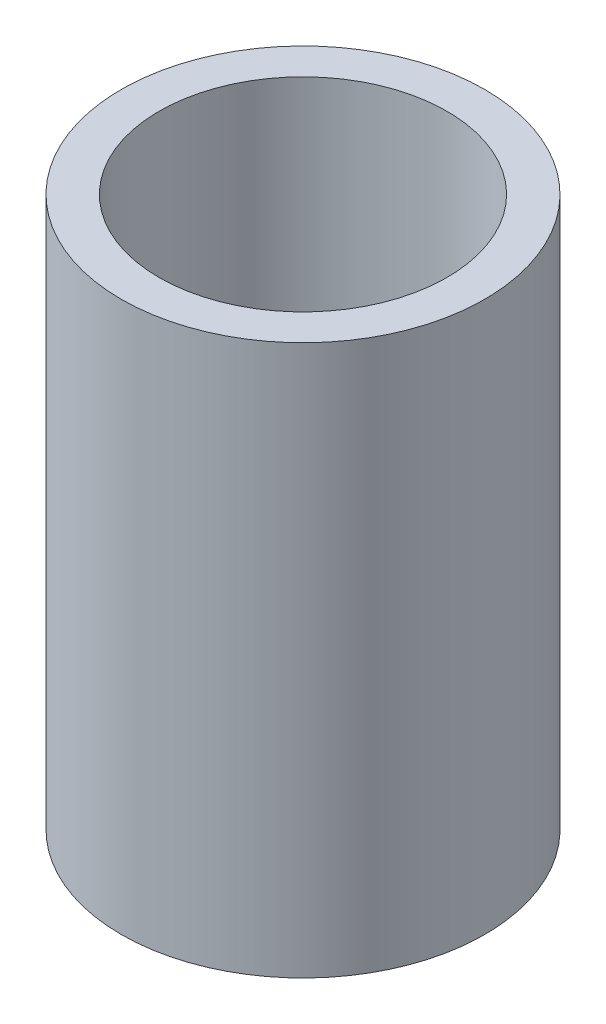
from build123d import *

# Parameters (mm, degrees)
SKETCH1_R           = 27.5
BOSS_EXTRUDE1_DEPTH = 83.244204937
SKETCH2_R           = 21.786591568
CUT_EXTRUDE1_DEPTH  = 92.880888413


with BuildPart() as part:
    # Sketch1 → Boss-Extrude1 (new body)
    with BuildSketch(Plane(origin=(0, 0, 0), x_dir=(1, 0, 0), z_dir=(0, 1, 0))):
        Circle(SKETCH1_R)
    extrude(amount=BOSS_EXTRUDE1_DEPTH)

    # Sketch2 → Cut-Extrude1 (cut, through all)
    with BuildSketch(Plane(origin=(0, 0, 0), x_dir=(1, 0, 0), z_dir=(0, 1, 0))):
        Circle(SKETCH2_R)
    extrude(amount=CUT_EXTRUDE1_DEPTH, mode=Mode.SUBTRACT)


solid = part.part
